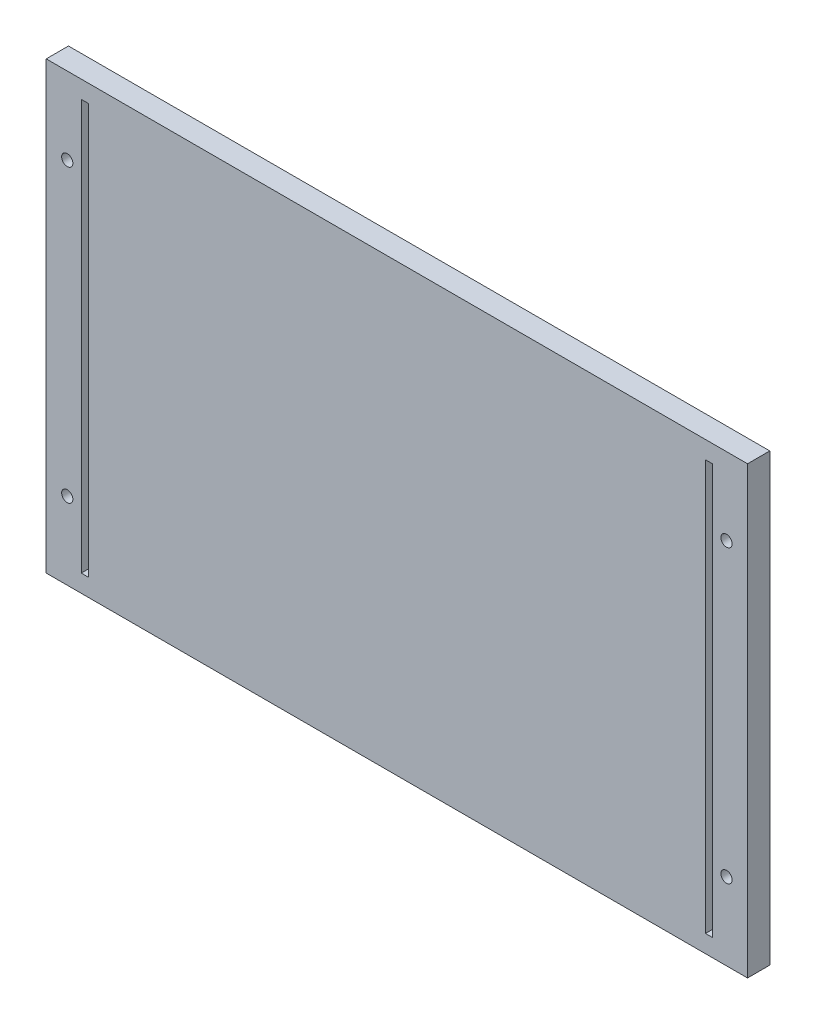
from build123d import *

# Parameters (mm, degrees)
SKETCH1_W          = 200
SKETCH1_H          = 127
SKETCH1_R          = 1.6
WALL_DEPTH         = 6.35
SKETCH6_W          = 2
SKETCH6_H          = 117
CUT_EXTRUDE1_DEPTH = 238.000680379


with BuildPart() as part:
    # Sketch1 → Wall (new body)
    with BuildSketch(Plane.XY):
        with Locations((100, 63.5)):
            Rectangle(SKETCH1_W, SKETCH1_H)
        with Locations((6, 105)):
            Circle(SKETCH1_R, mode=Mode.SUBTRACT)
        with Locations((194, 105)):
            Circle(SKETCH1_R, mode=Mode.SUBTRACT)
        with Locations((194, 22)):
            Circle(SKETCH1_R, mode=Mode.SUBTRACT)
        with Locations((6, 22)):
            Circle(SKETCH1_R, mode=Mode.SUBTRACT)
    extrude(amount=WALL_DEPTH)

    # Sketch6 → Cut-Extrude1 (cut, through all)
    with BuildSketch(Plane.XY.offset(6.35)):
        with Locations((11, 63.5)):
            Rectangle(SKETCH6_W, SKETCH6_H)
        with Locations((189, 63.5)):
            Rectangle(SKETCH6_W, SKETCH6_H)
    extrude(amount=-CUT_EXTRUDE1_DEPTH, mode=Mode.SUBTRACT)


solid = part.part
